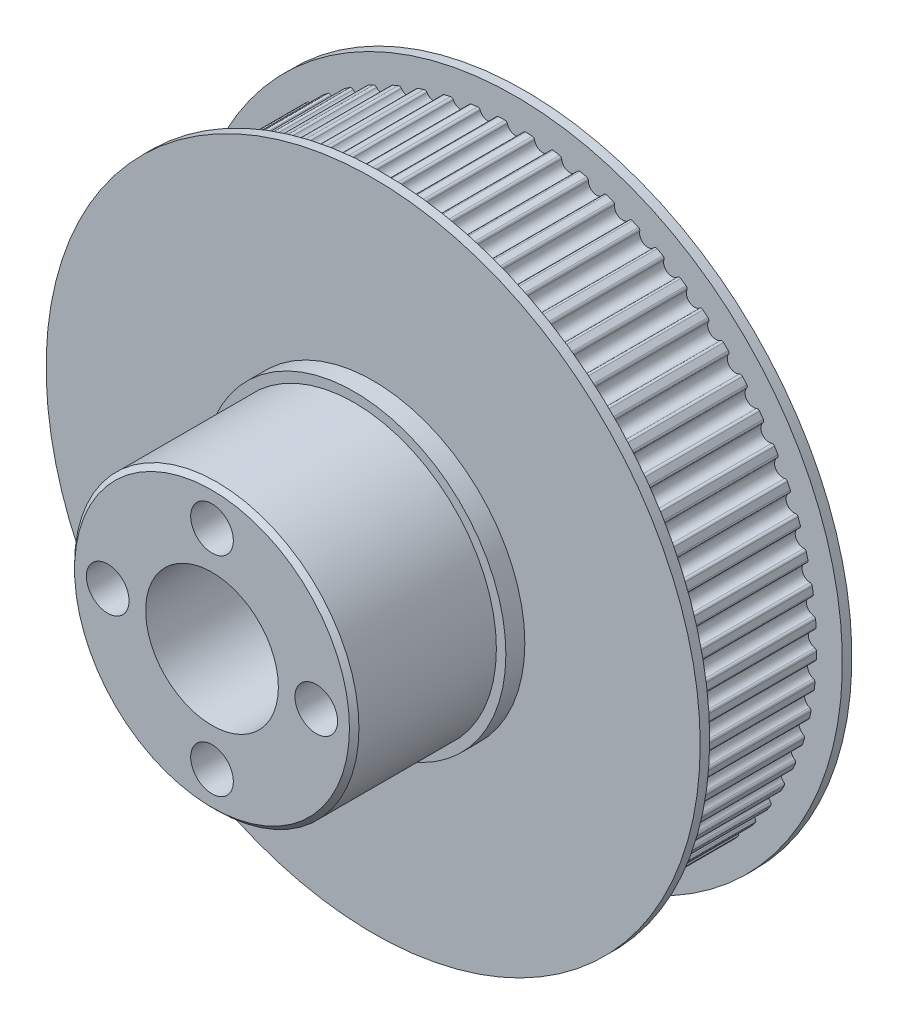
from build123d import *

# Parameters (mm, degrees)
SKETCH1_R           = 31.77507322
BOSS_EXTRUDE1_DEPTH = 7.5
CUT_EXTRUDE1_DEPTH  = 48.37415494
CIRPATTERN1_COUNT   = 69
SKETCH7_R           = 15
BOSS_EXTRUDE4_DEPTH = 17
SKETCH8_R           = 16
BOSS_EXTRUDE5_DEPTH = 2
SKETCH9_R           = 7
SKETCH9_R_2         = 2.25
CUT_EXTRUDE2_DEPTH  = 56.164904295
SKETCH10_R          = 3.6
CUT_EXTRUDE3_DEPTH  = 5
CIRPATTERN2_COUNT   = 4
CHAMFER1_SIZE       = 0.5
SKETCH14_R          = 34.5
BOSS_EXTRUDE7_DEPTH = 1
BOSS_EXTRUDE8_START = 1
SKETCH11_R          = 34.5
SKETCH11_R_2        = 3.6
SKETCH11_R_3        = 7
BOSS_EXTRUDE8_DEPTH = 1
SKETCH17_R          = 2.25
CUT_EXTRUDE4_DEPTH  = 59.902461748
SKETCH18_R          = 7
CUT_EXTRUDE5_DEPTH  = 59.902461748


with BuildPart() as part:
    # Sketch1 → Boss-Extrude1 (new, symmetric)
    with BuildSketch(Plane.XY):
        Circle(SKETCH1_R)
    extrude(amount=BOSS_EXTRUDE1_DEPTH, both=True)

    # Sketch2 → Cut-Extrude1 (cut, symmetric)
    with BuildSketch(Plane.XY.offset(7.5)):
        with BuildLine():
            ThreePointArc((-1.104041958, 31.755887163), (-0.939056755, 31.704080621), (-0.843059348, 31.560245531))
            ThreePointArc((-0.843059348, 31.560245531), (0, 30.90507322), (0.843059348, 31.560245531))
            ThreePointArc((0.843059348, 31.560245531), (0.939056755, 31.704080621), (1.104041958, 31.755887163))
            ThreePointArc((1.104041958, 31.755887163), (0, 31.77507322), (-1.104041958, 31.755887163))
        make_face()
    cut_extrude1 = extrude(amount=CUT_EXTRUDE1_DEPTH, both=True, mode=Mode.SUBTRACT)

    # CirPattern1: Cut-Extrude1 ×69 about axis
    cirpattern1_axis = Axis((0, 0, 7.5), (0, 0, -1))
    for i in range(1, CIRPATTERN1_COUNT):
        add(cut_extrude1.rotate(cirpattern1_axis, i * 360 / CIRPATTERN1_COUNT), mode=Mode.SUBTRACT)

    # Sketch7 → Boss-Extrude4 (add)
    with BuildSketch(Plane.XY.offset(7.5)):
        Circle(SKETCH7_R)
    extrude(amount=BOSS_EXTRUDE4_DEPTH)

    # Sketch8 → Boss-Extrude5 (add)
    with BuildSketch(Plane.XY.offset(7.5)):
        Circle(SKETCH8_R)
    extrude(amount=BOSS_EXTRUDE5_DEPTH)

    # Sketch9 → Cut-Extrude2 (cut, through all)
    with BuildSketch(Plane.XY.offset(24.5)):
        Circle(SKETCH9_R)
        with Locations((0, -11)):
            Circle(SKETCH9_R_2)
        with Locations((-11, 0)):
            Circle(SKETCH9_R_2)
        with Locations((0, 11)):
            Circle(SKETCH9_R_2)
        with Locations((11, 0)):
            Circle(SKETCH9_R_2)
    extrude(amount=-CUT_EXTRUDE2_DEPTH, mode=Mode.SUBTRACT)

    # Sketch10 → Cut-Extrude3 (cut)
    with BuildSketch(Plane(origin=(0, 0, -7.5), x_dir=(-1, 0, 0), z_dir=(0, 0, -1))):
        with Locations((11, 0)):
            Circle(SKETCH10_R)
    cut_extrude3 = extrude(amount=-CUT_EXTRUDE3_DEPTH, mode=Mode.SUBTRACT)

    # CirPattern2: Cut-Extrude3 ×4 about axis
    cirpattern2_axis = Axis((0, 0, -7.5), (0, 0, 1))
    for i in range(1, CIRPATTERN2_COUNT):
        add(cut_extrude3.rotate(cirpattern2_axis, i * 360 / CIRPATTERN2_COUNT), mode=Mode.SUBTRACT)

    # Chamfer1
    chamfer1_edges = [part.edges().sort_by_distance(p)[0] for p in [
        (-15, 0, 24.5),
    ]]
    chamfer(chamfer1_edges, length=CHAMFER1_SIZE)

    # Sketch14 → Boss-Extrude7 (add)
    with BuildSketch(Plane.XY.offset(7.5)):
        Circle(SKETCH14_R)
    extrude(amount=-BOSS_EXTRUDE7_DEPTH)

    # Sketch11 → Boss-Extrude8 (add)
    with BuildSketch(Plane(origin=(0, 0, -7.5), x_dir=(-1, 0, 0), z_dir=(0, 0, -1)).offset(BOSS_EXTRUDE8_START)):
        Circle(SKETCH11_R)
        with Locations((-11, 0)):
            Circle(SKETCH11_R_2, mode=Mode.SUBTRACT)
        with Locations((0, -11)):
            Circle(SKETCH11_R_2, mode=Mode.SUBTRACT)
        with Locations((0, 11)):
            Circle(SKETCH11_R_2, mode=Mode.SUBTRACT)
        Circle(SKETCH11_R_3, mode=Mode.SUBTRACT)
        with Locations((11, 0)):
            Circle(SKETCH11_R_2, mode=Mode.SUBTRACT)
    extrude(amount=-BOSS_EXTRUDE8_DEPTH)

    # Sketch17 → Cut-Extrude4 (cut, through all)
    with BuildSketch(Plane(origin=(0, 0, -8.5), x_dir=(-1, 0, 0), z_dir=(0, 0, -1))):
        with Locations((0, 11)):
            Circle(SKETCH17_R)
        with Locations((11, 0)):
            Circle(SKETCH17_R)
        with Locations((-11, 0)):
            Circle(SKETCH17_R)
        with Locations((0, -11)):
            Circle(SKETCH17_R)
    extrude(amount=-CUT_EXTRUDE4_DEPTH, mode=Mode.SUBTRACT)

    # Sketch18 → Cut-Extrude5 (cut, through all)
    with BuildSketch(Plane(origin=(0, 0, -8.5), x_dir=(-1, 0, 0), z_dir=(0, 0, -1))):
        Circle(SKETCH18_R)
    extrude(amount=-CUT_EXTRUDE5_DEPTH, mode=Mode.SUBTRACT)


solid = part.part
